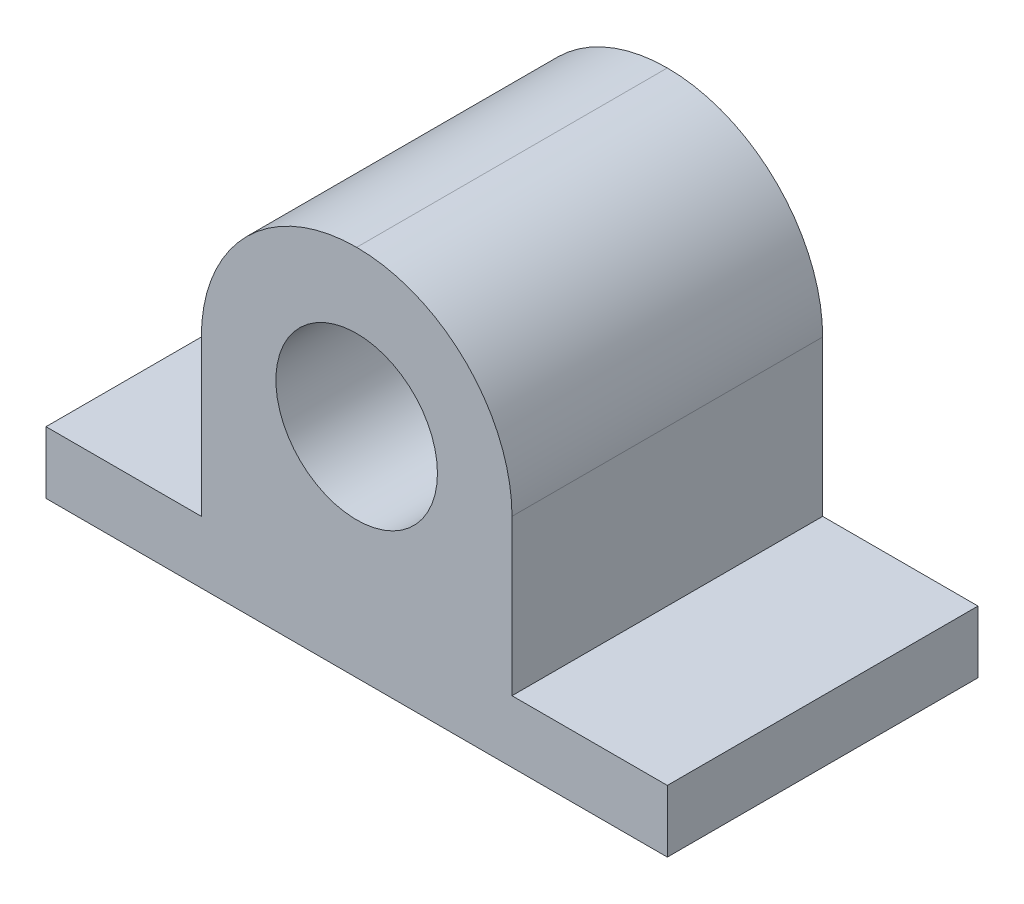
from build123d import *

# Parameters (mm, degrees)
CROQUIS1_W              = 20
CROQUIS1_H              = 10
SALIENTE_EXTRUIR1_DEPTH = 2
CROQUIS2_W              = 10
CROQUIS2_H              = 10
CROQUIS2_R              = 2.6
SALIENTE_EXTRUIR2_DEPTH = 10
REDONDEO1_R             = 5


with BuildPart() as part:
    # Croquis1 → Saliente-Extruir1 (new body)
    with BuildSketch(Plane(origin=(0, 0, 0), x_dir=(1, 0, 0), z_dir=(0, 1, 0))):
        with Locations((10, 5)):
            Rectangle(CROQUIS1_W, CROQUIS1_H)
    extrude(amount=SALIENTE_EXTRUIR1_DEPTH)

    # Croquis2 → Saliente-Extruir2 (add)
    with BuildSketch(Plane.XY):
        with Locations((10, 7)):
            Rectangle(CROQUIS2_W, CROQUIS2_H)
        with Locations((10, 7)):
            Circle(CROQUIS2_R, mode=Mode.SUBTRACT)
    extrude(amount=-SALIENTE_EXTRUIR2_DEPTH)

    # Redondeo1
    redondeo1_edges = [part.edges().sort_by_distance(p)[0] for p in [
        (15, 12, -5),
        (5, 12, -5),
    ]]
    fillet(redondeo1_edges, radius=REDONDEO1_R - 0.0001)  # a hair under: the kernel refuses the full size


solid = part.part
